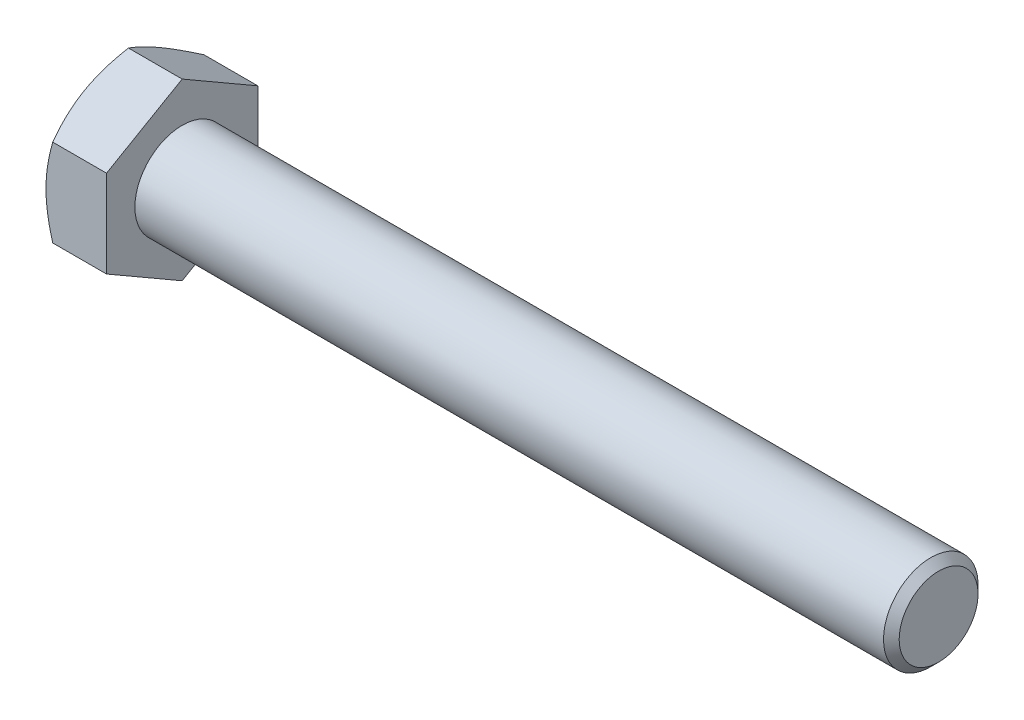
from build123d import *

# Parameters (mm, degrees)
BASEHEAD_DEPTH = 6.4


with BuildPart() as part:
    # BaseHeadSke → BaseHead (new body)
    with BuildSketch(Plane(origin=(0, 0, 0), x_dir=(0, 0, -1), z_dir=(1, 0, 0))):
        Polygon((0, 9.237604307), (-8, 4.618802154), (-8, -4.618802154), (0, -9.237604307), (8, -4.618802154), (8, 4.618802154), align=None)
    extrude(amount=BASEHEAD_DEPTH)

    # HeadChamferSke → HeadChamfer (revolve, cut)
    with BuildSketch(Plane.XY):
        Polygon((0, 9.237604307), (0, 8), (0.71453118, 9.237604307), align=None)
    revolve(axis=Axis((0, 0, 0), (1, 0, 0)), mode=Mode.SUBTRACT)

    # BodySke → BaseBody (revolve)
    with BuildSketch(Plane.XY):
        Polygon((0, 0), (0, 5), (85.572, 5), (86.4, 4.172), (86.4, 0), align=None)
    revolve(axis=Axis((0, 0, 0), (1, 0, 0)))


solid = part.part
